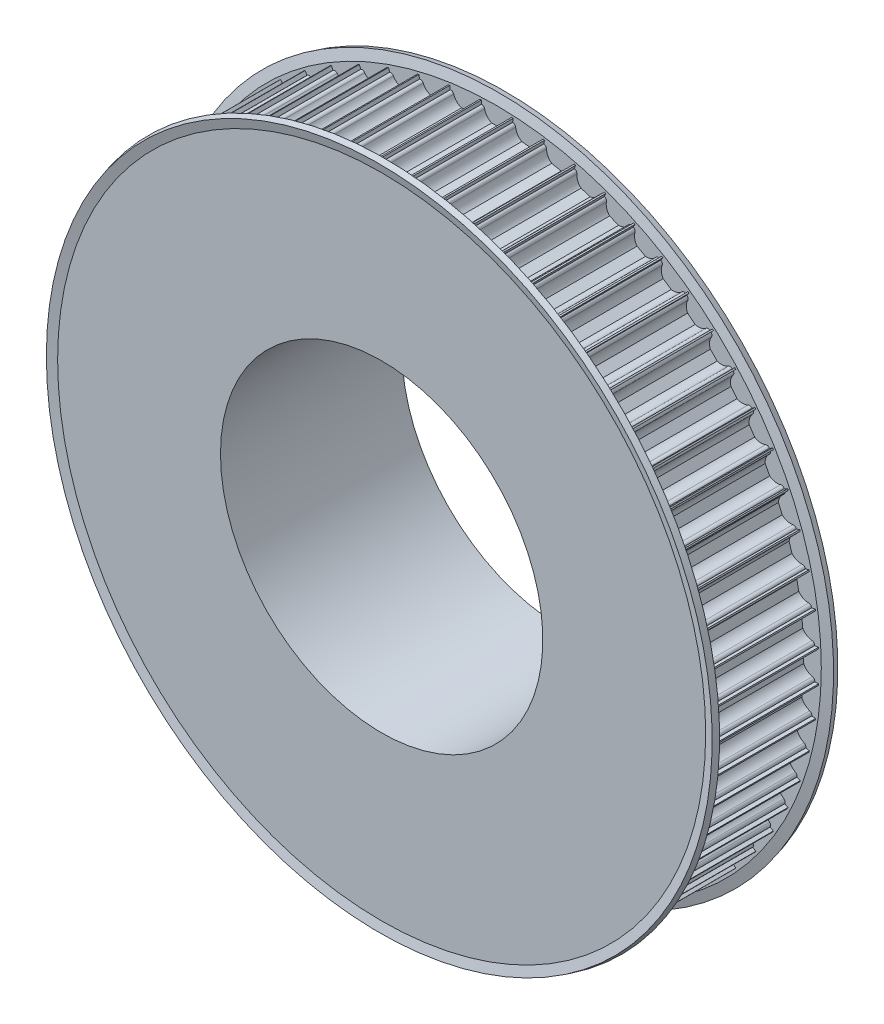
from build123d import *

# Parameters (mm, degrees)
CUT_EXTRUDE1_DEPTH = 122.757956619
CIRPATTERN1_COUNT  = 64


with BuildPart() as part:
    # Sketch1 → Revolve1 (revolve)
    with BuildSketch(Plane(origin=(0, 0, 0), x_dir=(0, 0, -1), z_dir=(1, 0, 0)), mode=Mode.PRIVATE) as revolve1_sk:
        Polygon((0, 40), (0, 80), (30, 80), (30, 55.5), (45, 55.5), (45, 40), align=None)
    revolve(revolve1_sk.sketch.rotate(Axis((0, 0, -88.99), (0, 0, 1)), 90), axis=Axis((0, 0, -88.99), (0, 0, 1)))

    # Sketch2 → Cut-Extrude1 (cut, through all)
    with BuildSketch(Plane.XY):
        with BuildLine():
            Line((3.674234614, 79), (3.75, 79))
            Line((3.75, 79), (3.75, 81))
            Line((3.75, 81), (-3.75, 81))
            Line((-3.75, 81), (-3.75, 79))
            Line((-3.75, 79), (-3.674234614, 79))
            ThreePointArc((-3.674234614, 79), (-3.199892965, 78.830947502), (-2.939387691, 78.4))
            ThreePointArc((-2.939387691, 78.4), (-2.331759211, 77.112435701), (-1.198957881, 76.25))
            Line((-1.198957881, 76.25), (1.198957881, 76.25))
            ThreePointArc((1.198957881, 76.25), (2.331759211, 77.112435701), (2.939387691, 78.4))
            ThreePointArc((2.939387691, 78.4), (3.199892965, 78.830947502), (3.674234614, 79))
        make_face()
    cut_extrude1 = extrude(amount=-CUT_EXTRUDE1_DEPTH, mode=Mode.SUBTRACT)

    # CirPattern1: Cut-Extrude1 ×64 about axis
    cirpattern1_axis = Axis((0, 0, 0), (0, 0, 1))
    for i in range(1, CIRPATTERN1_COUNT):
        add(cut_extrude1.rotate(cirpattern1_axis, i * 360 / CIRPATTERN1_COUNT), mode=Mode.SUBTRACT)

    # Sketch3 → Revolve2 (revolve)
    with BuildSketch(Plane(origin=(0, 0, 0), x_dir=(0, 0, -1), z_dir=(1, 0, 0)), mode=Mode.PRIVATE) as revolve2_sk:
        Polygon((0, 80.414582296), (0, 75.612061042), (1.5, 75.612061042), (1.5, 80.612061042), (0.856921938, 83.012061042), (-0.591966801, 82.623832474), align=None)
        Polygon((30.591966801, 82.623832474), (29.143078062, 83.012061042), (28.5, 80.612061042), (28.5, 75.612061042), (30, 75.612061042), (30, 80.414582296), align=None)
    revolve(revolve2_sk.sketch.rotate(Axis((0, 0, -88.99), (0, 0, 1)), 90), axis=Axis((0, 0, -88.99), (0, 0, 1)))


solid = part.part
